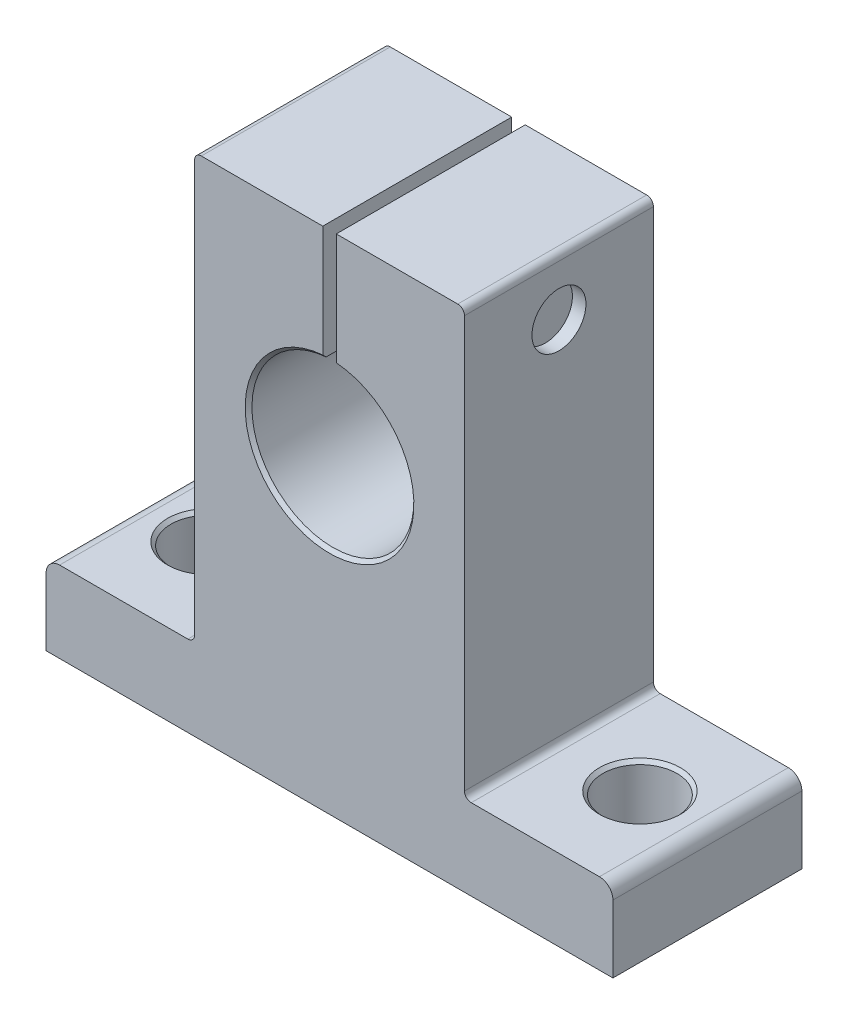
from build123d import *

# Parameters (mm, degrees)
BOSS_EXTRUDE1_DEPTH     = 14
CUT_EXTRUDE1_DEPTH      = 46.202322949
CUT_EXTRUDE1_DEPTH_BACK = 6
SKETCH3_R               = 2.75
FILLET1_R               = 1
FILLET2_R               = 0.5
CHAMFER1_SIZE           = 0.25
SKETCH4_R               = 3.1
CUT_EXTRUDE2_DEPTH      = 1
SKETCH5_R               = 3.1
SKETCH5_R_2             = 3
CUT_EXTRUDE3_DEPTH      = 4
CHAMFER2_SIZE           = 0.2
CUT_EXTRUDE4_DEPTH      = 2
SKETCH7_R               = 2
BOSS_EXTRUDE2_DEPTH     = 1
CUT_EXTRUDE5_START      = -1
SKETCH8_R               = 2
CUT_EXTRUDE5_DEPTH      = 1
SKETCH9_R               = 1.732050808
CUT_EXTRUDE6_DEPTH      = 1
CUT_EXTRUDE6_DRAFT      = -45


with BuildPart() as part:
    # Sketch1 → Boss-Extrude1 (new body)
    with BuildSketch(Plane.XY):
        with BuildLine():
            Line((-21, 0), (21, 0))
            Line((21, 0), (21, 6))
            Line((21, 6), (10, 6))
            Line((10, 6), (10, 37.5))
            Line((10, 37.5), (0.5, 37.5))
            Line((0.5, 37.5), (0.5, 28.979130372))
            ThreePointArc((0.5, 28.979130372), (0, 17), (-0.5, 28.979130372))
            Line((-0.5, 28.979130372), (-0.5, 37.5))
            Line((-0.5, 37.5), (-10, 37.5))
            Line((-10, 37.5), (-10, 6))
            Line((-10, 6), (-21, 6))
            Line((-21, 6), (-21, 0))
        make_face()
    extrude(amount=BOSS_EXTRUDE1_DEPTH)

    # Sketch3 → Cut-Extrude1 (cut, two sides: drawn at the far end of the back side and taken through both)
    with BuildSketch(Plane.XZ.offset(-CUT_EXTRUDE1_DEPTH_BACK)):
        with Locations((-16, 7)):
            Circle(SKETCH3_R)
        with Locations((16, 7)):
            Circle(SKETCH3_R)
    extrude(amount=CUT_EXTRUDE1_DEPTH + CUT_EXTRUDE1_DEPTH_BACK, mode=Mode.SUBTRACT)

    # Fillet1
    fillet1_edges = [part.edges().sort_by_distance(p)[0] for p in [
        (21, 6, 7),
        (-21, 6, 7),
    ]]
    fillet(fillet1_edges, radius=FILLET1_R)

    # Fillet2
    fillet2_edges = [part.edges().sort_by_distance(p)[0] for p in [
        (-10, 37.5, 7),
        (10, 37.5, 7),
        (10, 6, 7),
        (-10, 6, 7),
    ]]
    fillet(fillet2_edges, radius=FILLET2_R)

    # Chamfer1
    chamfer1_edges = [part.edges().sort_by_distance(p)[0] for p in [
        (-18.75, 0, 7),
        (13.25, 0, 7),
        (13.25, 6, 7),
        (-18.75, 6, 7),
        (0, 17, 0),
        (0, 17, 14),
    ]]
    chamfer(chamfer1_edges, length=CHAMFER1_SIZE)

    # Sketch4 → Cut-Extrude2 (cut)
    with BuildSketch(Plane.ZY.offset(10)):
        with Locations((7, 33.25)):
            Circle(SKETCH4_R)
    extrude(amount=-CUT_EXTRUDE2_DEPTH, mode=Mode.SUBTRACT)

    # Sketch5 → Cut-Extrude3 (cut)
    with BuildSketch(Plane.ZY.offset(9)):
        with Locations((7, 33.25)):
            Circle(SKETCH5_R)
        with Locations((7, 33.25)):
            Circle(SKETCH5_R_2, mode=Mode.SUBTRACT)
    extrude(amount=-CUT_EXTRUDE3_DEPTH, mode=Mode.SUBTRACT)

    # Chamfer2
    chamfer2_edges = [part.edges().sort_by_distance(p)[0] for p in [
        (-9, 33.25, 4),
    ]]
    chamfer(chamfer2_edges, length=CHAMFER2_SIZE)

    # Sketch6 → Cut-Extrude4 (cut)
    with BuildSketch(Plane.ZY.offset(9)):
        Polygon((7.246062581, 31.535516636), (8.607817438, 32.605854763), (8.361754858, 34.320338128), (6.753937419, 34.964483364), (5.392182562, 33.894145237), (5.638245142, 32.179661872), align=None)
    extrude(amount=-CUT_EXTRUDE4_DEPTH, mode=Mode.SUBTRACT)

    # Sketch7 → Boss-Extrude2 (add)
    with BuildSketch(Plane(origin=(-0.5, 0, 0), x_dir=(0, 0, -1), z_dir=(1, 0, 0))):
        with Locations((-7, 33.25)):
            Circle(SKETCH7_R)
    extrude(amount=BOSS_EXTRUDE2_DEPTH)

    # Sketch8 → Cut-Extrude5 (cut)
    with BuildSketch(Plane(origin=(10, 0, 0), x_dir=(0, 0, -1), z_dir=(1, 0, 0)).offset(CUT_EXTRUDE5_START)):
        with Locations((-7, 33.25)):
            Circle(SKETCH8_R)
    extrude(amount=CUT_EXTRUDE5_DEPTH, mode=Mode.SUBTRACT)


with BuildPart() as cut_extrude6_tool:
    # Sketch9 → Cut-Extrude6 (with draft: the straight prism first)
    with BuildSketch(Plane.ZY.offset(9)):
        with Locations((7, 33.25)):
            Circle(SKETCH9_R)
    extrude(amount=-CUT_EXTRUDE6_DEPTH)
    # Cut-Extrude6: the draft: its side faces are tilted about the plane it starts from
    cut_extrude6_sides = [cut_extrude6_tool.faces().sort_by_distance(p)[0] for p in [
        (-8.5, 33.25, 5.267949192),
    ]]
    draft(cut_extrude6_sides, Plane.ZY.offset(9), CUT_EXTRUDE6_DRAFT)


with BuildPart() as part_1:
    add(part.part)

    # Cut-Extrude6: cut by cut_extrude6_tool
    add(cut_extrude6_tool.part, mode=Mode.SUBTRACT)


solid = part_1.part
